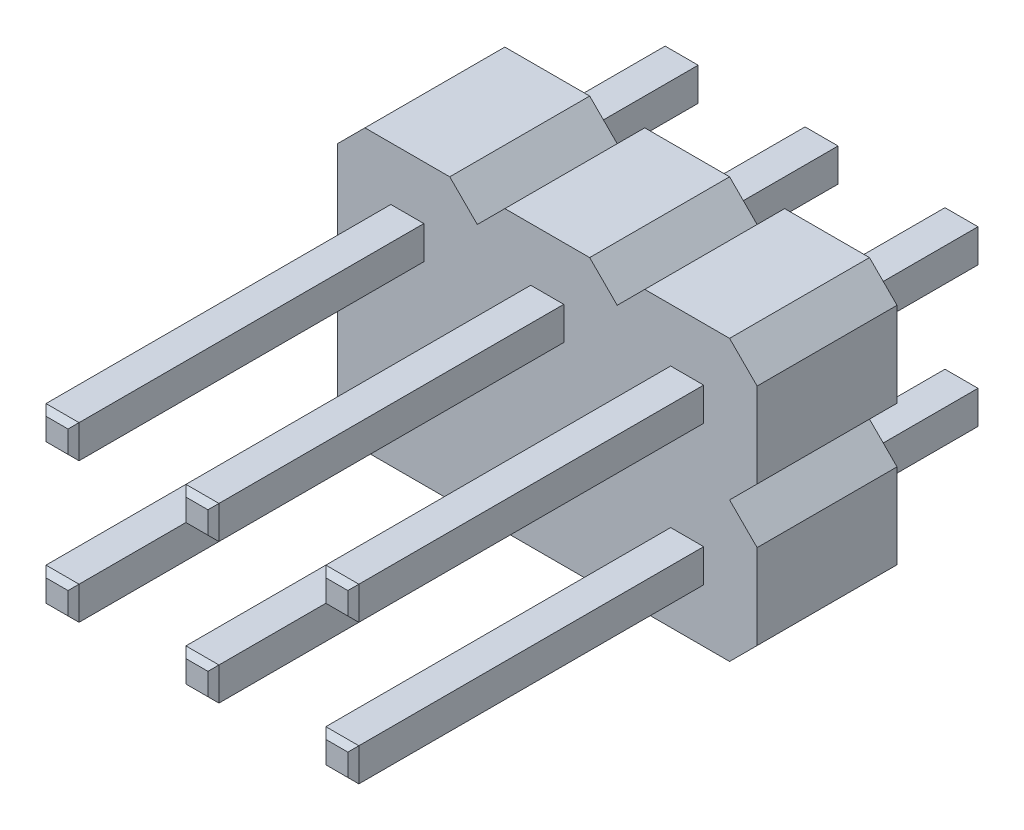
from build123d import *

# Parameters (mm, degrees)
PLASTIC_DEPTH                     = 2.54
SKETCH2_W                         = 11.44
SKETCH2_H                         = 0.6
CONTACT_DEPTH                     = 0.3
CHAMFER1_SIZE                     = 0.1
PATTERN_LINEAR_1_COUNT            = 3
PATTERN_LINEAR_1_PITCH            = 2.54
PATTERN_LINEAR_1_COUNT_DIR2       = 2
PATTERN_LINEAR_1_PITCH_DIR2       = 2.54
CHAMFER1_OF_PATTERN_LINEAR_1_SIZE = 0.1


with BuildPart() as part:
    # Sketch1 → Plastic (new body)
    with BuildSketch(Plane.XY):
        Polygon((-0.77, 1.27), (0.77, 1.27), (1.27, 0.77), (1.27, -0.77), (0.77, -1.27), (-0.77, -1.27), (-1.27, -0.77), (-1.27, 0.77), align=None)
    plastic = extrude(amount=PLASTIC_DEPTH)

    # Sketch2 → Contact (add, symmetric)
    with BuildSketch(Plane(origin=(0, 0, 0), x_dir=(0, 0, -1), z_dir=(1, 0, 0))):
        with Locations((-3.18, 0)):
            Rectangle(SKETCH2_W, SKETCH2_H)
    contact = extrude(amount=CONTACT_DEPTH, both=True)

    # Chamfer1
    chamfer1_edges = [part.edges().sort_by_distance(p)[0] for p in [
        (0.3, 0, -2.54),
        (0, -0.3, -2.54),
        (-0.3, 0, -2.54),
        (0, 0.3, -2.54),
        (-0.3, 0, 8.9),
        (0, 0.3, 8.9),
        (0.3, 0, 8.9),
        (0, -0.3, 8.9),
    ]]
    chamfer(chamfer1_edges, length=CHAMFER1_SIZE)

    # Линейный массив1: Plastic, Contact 3 × 2
    with Locations(*[(i * PATTERN_LINEAR_1_PITCH, j * PATTERN_LINEAR_1_PITCH_DIR2, 0) for i in range(PATTERN_LINEAR_1_COUNT) for j in range(PATTERN_LINEAR_1_COUNT_DIR2) if (i, j) != (0, 0)]):
        add(plastic)
        add(contact)

    # Chamfer1 of Линейный массив1
    chamfer1_of_pattern_linear_1_edges = [part.edges().sort_by_distance(p)[0] for p in [
        (0.3, 2.54, -2.54),
        (0, 2.24, -2.54),
        (-0.3, 2.54, -2.54),
        (0, 2.84, -2.54),
        (-0.3, 2.54, 8.9),
        (0, 2.84, 8.9),
        (0.3, 2.54, 8.9),
        (0, 2.24, 8.9),
        (2.84, 0, -2.54),
        (2.54, -0.3, -2.54),
        (2.24, 0, -2.54),
        (2.54, 0.3, -2.54),
        (2.24, 0, 8.9),
        (2.54, 0.3, 8.9),
        (2.84, 0, 8.9),
        (2.54, -0.3, 8.9),
        (2.84, 2.54, -2.54),
        (2.54, 2.24, -2.54),
        (2.24, 2.54, -2.54),
        (2.54, 2.84, -2.54),
        (2.24, 2.54, 8.9),
        (2.54, 2.84, 8.9),
        (2.84, 2.54, 8.9),
        (2.54, 2.24, 8.9),
        (5.38, 0, -2.54),
        (5.08, -0.3, -2.54),
        (4.78, 0, -2.54),
        (5.08, 0.3, -2.54),
        (4.78, 0, 8.9),
        (5.08, 0.3, 8.9),
        (5.38, 0, 8.9),
        (5.08, -0.3, 8.9),
        (5.38, 2.54, -2.54),
        (5.08, 2.24, -2.54),
        (4.78, 2.54, -2.54),
        (5.08, 2.84, -2.54),
        (4.78, 2.54, 8.9),
        (5.08, 2.84, 8.9),
        (5.38, 2.54, 8.9),
        (5.08, 2.24, 8.9),
    ]]
    chamfer(chamfer1_of_pattern_linear_1_edges, length=CHAMFER1_OF_PATTERN_LINEAR_1_SIZE)


solid = part.part
